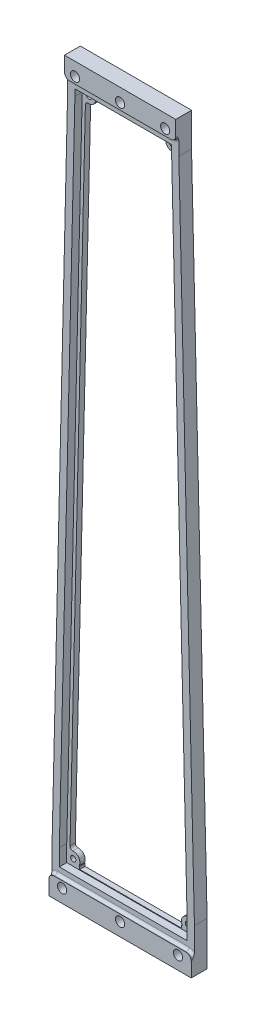
from build123d import *

# Parameters (mm, degrees)
SKETCH_2_R      = 1
EXTRUDE_1_DEPTH = 2
EXTRUDE_2_DEPTH = 2
EXTRUDE_3_DEPTH = 2.8
SKETCH_5_R      = 1.75
EXTRUDE_4_DEPTH = 4.8
EXTRUDE_START   = 1.2
SKETCH_6_R      = 1.75
EXTRUDE_5_DEPTH = 1.2
FILLET_1_R      = 1


with BuildPart() as part:
    # 草图2 → 凸台-拉伸1 (new body)
    with BuildSketch(Plane(origin=(0, 0, -1.538354077), x_dir=(-1, 0, 0), z_dir=(0, 0, -1))):
        with BuildLine():
            Line((-22.942959106, -124.662212149), (-17.134907671, 121.132350923))
            ThreePointArc((-17.134907671, 121.132350923), (-16.793190136, 121.861742775), (-16.024570953, 122.102591063))
            ThreePointArc((-16.024570953, 122.102591063), (-14.009380987, 122.790837638), (-13.255665128, 124.782466708))
            ThreePointArc((-13.255665128, 124.782466708), (-12.992914403, 125.539491489), (-12.25871858, 125.860553721))
            Line((-12.25871858, 125.860553721), (12.25871858, 125.860553721))
            ThreePointArc((12.25871858, 125.860553721), (12.992914403, 125.539491489), (13.255665128, 124.782466708))
            ThreePointArc((13.255665128, 124.782466708), (14.009380087, 122.79083851), (16.024568463, 122.102590786))
            ThreePointArc((16.024568463, 122.102590786), (16.793187022, 121.861742062), (17.134904184, 121.13235055))
            Line((17.134904184, 121.13235055), (22.942959106, -124.662212156))
            Line((22.942959106, -124.662212156), (22.942959106, -124.904555532))
            ThreePointArc((22.942959106, -124.904555532), (22.626864313, -125.634126411), (21.878411771, -125.902470178))
            ThreePointArc((21.878411771, -125.902470178), (19.586380534, -127.089481736), (19.565603095, -129.670561341))
            Line((19.565603095, -129.670561341), (19.265011022, -129.670561341))
            Line((19.265011022, -129.670561341), (19.265011022, -130.670561341))
            Line((19.265011022, -130.670561341), (23.942959106, -130.670561341))
            Line((23.942959106, -130.670561341), (23.942959106, -124.650398948))
            Line((23.942959106, -124.650398948), (18.052063488, 124.649948906))
            Line((18.052063488, 124.649948906), (18.052059944, 126.860553721))
            Line((18.052059944, 126.860553721), (-18.052059944, 126.860553721))
            Line((-18.052059944, 126.860553721), (-18.052059944, 124.65024892))
            Line((-18.052059944, 124.65024892), (-23.942959106, -124.650398948))
            Line((-23.942959106, -124.650398948), (-23.942959106, -130.670561341))
            Line((-23.942959106, -130.670561341), (-19.234988978, -130.670561341))
            Line((-19.234988978, -130.670561341), (-19.234988978, -129.670561341))
            Line((-19.234988978, -129.670561341), (-19.646017972, -129.670561341))
            ThreePointArc((-19.646017972, -129.670561341), (-19.548027097, -127.027128176), (-21.878411771, -125.775469924))
            ThreePointArc((-21.878411771, -125.775469924), (-22.626864313, -125.507126157), (-22.942959106, -124.777555278))
            Line((-22.942959106, -124.777555278), (-22.942959106, -124.662212149))
        make_face()
        with Locations((-21.717043434, -128.270256541)):
            Circle(SKETCH_2_R, mode=Mode.SUBTRACT)
        with Locations((21.717043434, -128.397256794)):
            Circle(SKETCH_2_R, mode=Mode.SUBTRACT)
        with Locations((-15.748031496, 124.587249174)):
            Circle(SKETCH_2_R, mode=Mode.SUBTRACT)
        with Locations((15.748031496, 124.587249174)):
            Circle(SKETCH_2_R, mode=Mode.SUBTRACT)
    extrude(amount=EXTRUDE_1_DEPTH)

    # 草图3 → 凸台-拉伸2 (add)
    with BuildSketch(Plane(origin=(0, 0, -3.538354077), x_dir=(-1, 0, 0), z_dir=(0, 0, -1))):
        Polygon((26.942959106, -124.614959326), (21.052063431, 124.685390934), (21.052055134, 129.860553721), (-21.052059944, 129.860553721), (-21.052059944, 124.685688522), (-26.942959106, -124.614959347), (-26.942959106, -133.670561341), (26.942959106, -133.670561341), align=None)
        Polygon((18.052059944, 126.860553721), (-18.052059944, 126.860553721), (-18.052059944, 124.65024892), (-23.942959106, -124.650398948), (-23.942959106, -130.670561341), (23.942959106, -130.670561341), (23.942959106, -124.650398948), (18.052063488, 124.649948906), align=None, mode=Mode.SUBTRACT)
    extrude(amount=-EXTRUDE_2_DEPTH)

    # 草图4 → 凸台-拉伸3 (add)
    with BuildSketch(Plane.XY.offset(-1.538354077)):
        Polygon((-21.052063431, 124.685390934), (-26.942959106, -124.614959326), (-26.942959106, -133.670561341), (26.942959106, -133.670561341), (26.942959106, -124.614959347), (21.052059944, 124.685688522), (21.052059944, 129.860553721), (-21.052055134, 129.860553721), align=None)
        Polygon((-18.302059543, 127.110553721), (-18.302063484, 124.652902409), (-24.192959106, -124.647445647), (-24.192959106, -130.920561341), (24.192959106, -130.920561341), (24.192959106, -124.647445648), (18.302059944, 124.653202221), (18.302059944, 127.110553721), align=None, mode=Mode.SUBTRACT)
    extrude(amount=EXTRUDE_3_DEPTH)

    # 草图5 → 凸台-拉伸4 (add)
    # profile 1 of 2: a face of its own
    with BuildSketch(Plane.XY.offset(1.261645923)):
        Polygon((-26.942959106, -133.670561341), (26.942959106, -133.670561341), (26.942959106, -138.670561341), (26.942959106, -141.170561341), (-26.942959106, -141.170561341), (-26.942959106, -138.670561341), align=None)
        with Locations((2.405e-06, -136.170561341)):
            Circle(SKETCH_5_R, mode=Mode.SUBTRACT)
        with Locations((21.942959106, -136.170561341)):
            Circle(SKETCH_5_R, mode=Mode.SUBTRACT)
        with Locations((-21.942959106, -136.170561341)):
            Circle(SKETCH_5_R, mode=Mode.SUBTRACT)
    # profile 2 of 2: a face of its own
    with BuildSketch(Plane.XY.offset(1.261645923)):
        Polygon((21.052059944, 129.860553721), (-21.052055134, 129.860553721), (-21.052055134, 134.860553721), (-21.052055134, 137.360553721), (21.052059944, 137.360553721), (21.052059944, 134.860553721), align=None)
        with Locations((-17.052055134, 132.360553721)):
            Circle(SKETCH_5_R, mode=Mode.SUBTRACT)
        with Locations((17.052059944, 132.360553721)):
            Circle(SKETCH_5_R, mode=Mode.SUBTRACT)
        with Locations((2.405e-06, 132.360553721)):
            Circle(SKETCH_5_R, mode=Mode.SUBTRACT)
    extrude(amount=-EXTRUDE_4_DEPTH)

    # 草图6 → 凸台-拉伸5 (add)
    # profile 1 of 2: a face of its own
    with BuildSketch(Plane.XY.offset(1.261645923).offset(EXTRUDE_START)):
        with BuildLine():
            Line((-26.942959106, -138.670561341), (-26.942959106, -141.170561341))
            Line((-26.942959106, -141.170561341), (26.942959106, -141.170561341))
            Line((26.942959106, -141.170561341), (26.942959106, -138.670561341))
            Line((26.942959106, -138.670561341), (26.942959106, -135.670561341))
            ThreePointArc((26.942959106, -135.670561341), (26.357172668, -134.256347779), (24.942959106, -133.670561341))
            Line((24.942959106, -133.670561341), (-24.942959106, -133.670561341))
            ThreePointArc((-24.942959106, -133.670561341), (-26.357172668, -134.256347779), (-26.942959106, -135.670561341))
            Line((-26.942959106, -135.670561341), (-26.942959106, -138.670561341))
        make_face()
        with Locations((21.942959106, -136.170561341)):
            Circle(SKETCH_6_R, mode=Mode.SUBTRACT)
        with Locations((2.405e-06, -136.170561341)):
            Circle(SKETCH_6_R, mode=Mode.SUBTRACT)
        with Locations((-21.942959106, -136.170561341)):
            Circle(SKETCH_6_R, mode=Mode.SUBTRACT)
    # profile 2 of 2: a face of its own
    with BuildSketch(Plane.XY.offset(1.261645923).offset(EXTRUDE_START)):
        with BuildLine():
            Line((21.052059944, 131.860553721), (21.052059944, 134.860553721))
            Line((21.052059944, 134.860553721), (21.052059944, 137.360553721))
            Line((21.052059944, 137.360553721), (-21.052055134, 137.360553721))
            Line((-21.052055134, 137.360553721), (-21.052055134, 134.860553721))
            Line((-21.052055134, 134.860553721), (-21.052055134, 131.860553721))
            ThreePointArc((-21.052055134, 131.860553721), (-20.466268697, 130.446340159), (-19.052055134, 129.860553721))
            Line((-19.052055134, 129.860553721), (19.052059944, 129.860553721))
            ThreePointArc((19.052059944, 129.860553721), (20.466273506, 130.446340159), (21.052059944, 131.860553721))
        make_face()
        with Locations((17.052059944, 132.360553721)):
            Circle(SKETCH_6_R, mode=Mode.SUBTRACT)
        with Locations((2.405e-06, 132.360553721)):
            Circle(SKETCH_6_R, mode=Mode.SUBTRACT)
        with Locations((-17.052055134, 132.360553721)):
            Circle(SKETCH_6_R, mode=Mode.SUBTRACT)
    extrude(amount=-EXTRUDE_5_DEPTH)

    # 圆角1
    # the kernel refuses this fillet: 1 mm, written as the material it adds along each edge
    with BuildSketch(Plane(origin=(24.942959106, -135.670561341, 1.261645923), x_dir=(0.31484580408697693, -0.9491428341660831, 0), z_dir=(-0.9491428341660831, -0.31484580408697693, 0))) as fillet_1_piece_1_section:
        with BuildLine():
            CenterArc((2 + FILLET_1_R, FILLET_1_R), FILLET_1_R, 180, 90)
            Line((2, FILLET_1_R), (2, 0))
            Line((2, 0), (2 + FILLET_1_R, 0))
        make_face()
    fillet_1_piece_1 = revolve(axis=Axis((24.942959106, -135.670561341, 1.261645923), (0, 0, 1)), revolution_arc=161.648494619, mode=Mode.PRIVATE)
    fillet_1_piece_1 = split(fillet_1_piece_1, bisect_by=Plane(origin=(26.942959106, -134.20836544, 1.533797611), z_dir=(-1, 0, 0)), keep=Keep.TOP, mode=Mode.PRIVATE)
    add(fillet_1_piece_1)
    with BuildSketch(Plane(origin=(-24.942959106, -135.670561341, 1.261645923), x_dir=(0, 1, 0), z_dir=(1, 0, 0))) as fillet_1_piece_2_section:
        with BuildLine():
            CenterArc((2 + FILLET_1_R, FILLET_1_R), FILLET_1_R, 180, 90)
            Line((2 + FILLET_1_R, 0), (2, 0))
            Line((2, 0), (2, FILLET_1_R))
        make_face()
    fillet_1_piece_2 = revolve(axis=Axis((-24.942959106, -135.670561341, 1.261645923), (0, 0, 1)), revolution_arc=161.648494619, mode=Mode.PRIVATE)
    fillet_1_piece_2 = split(fillet_1_piece_2, bisect_by=Plane(origin=(-26.942959106, -134.20836489, 1.533796612), z_dir=(1, 0, 0)), keep=Keep.TOP, mode=Mode.PRIVATE)
    add(fillet_1_piece_2)
    with BuildSketch(Plane(origin=(-19.052055134, 131.860553721, 1.261645923), x_dir=(-0.31484580408698715, 0.9491428341660799, 0), z_dir=(0.9491428341660799, 0.31484580408698715, 0))) as fillet_1_piece_3_section:
        with BuildLine():
            CenterArc((2 + FILLET_1_R, FILLET_1_R), FILLET_1_R, 180, 90)
            Line((2, FILLET_1_R), (2, 0))
            Line((2, 0), (2 + FILLET_1_R, 0))
        make_face()
    fillet_1_piece_3 = revolve(axis=Axis((-19.052055134, 131.860553721, 1.261645923), (0, 0, 1)), revolution_arc=161.648494619, mode=Mode.PRIVATE)
    fillet_1_piece_3 = split(fillet_1_piece_3, bisect_by=Plane(origin=(-21.052055134, 130.742519817, 1.42831269), z_dir=(1, 0, 0)), keep=Keep.TOP, mode=Mode.PRIVATE)
    add(fillet_1_piece_3)
    with BuildSketch(Plane(origin=(19.052059944, 131.860553721, 1.261645923), x_dir=(0, -1, 0), z_dir=(-1, 0, 0))) as fillet_1_piece_4_section:
        with BuildLine():
            CenterArc((2 + FILLET_1_R, FILLET_1_R), FILLET_1_R, 180, 90)
            Line((2, FILLET_1_R), (2, 0))
            Line((2, 0), (2 + FILLET_1_R, 0))
        make_face()
    fillet_1_piece_4 = revolve(axis=Axis((19.052059944, 131.860553721, 1.261645923), (0, 0, 1)), revolution_arc=161.648494619, mode=Mode.PRIVATE)
    fillet_1_piece_4 = split(fillet_1_piece_4, bisect_by=Plane(origin=(21.052059944, 129.648450881, 1.424284575), z_dir=(-1, 0, 0)), keep=Keep.TOP, mode=Mode.PRIVATE)
    add(fillet_1_piece_4)
    with BuildSketch(Plane(origin=(24.942959106, -133.670561341, 1.261645923), x_dir=(0, 1, 0), z_dir=(-1, 0, 0))) as fillet_1_piece_5:
        with BuildLine():
            CenterArc((FILLET_1_R, -FILLET_1_R), FILLET_1_R, 90, 90)
            Line((0, -FILLET_1_R), (0, 0))
            Line((0, 0), (FILLET_1_R, 0))
        make_face()
    extrude(amount=49.885918212)
    with BuildSketch(Plane(origin=(-19.052055134, 129.860553721, 1.261645923), x_dir=(0, -1, 0), z_dir=(1, 0, 0))) as fillet_1_piece_6:
        with BuildLine():
            CenterArc((FILLET_1_R, -FILLET_1_R), FILLET_1_R, 90, 90)
            Line((0, -FILLET_1_R), (0, 0))
            Line((0, 0), (FILLET_1_R, 0))
        make_face()
    extrude(amount=38.104115079)


solid = part.part
